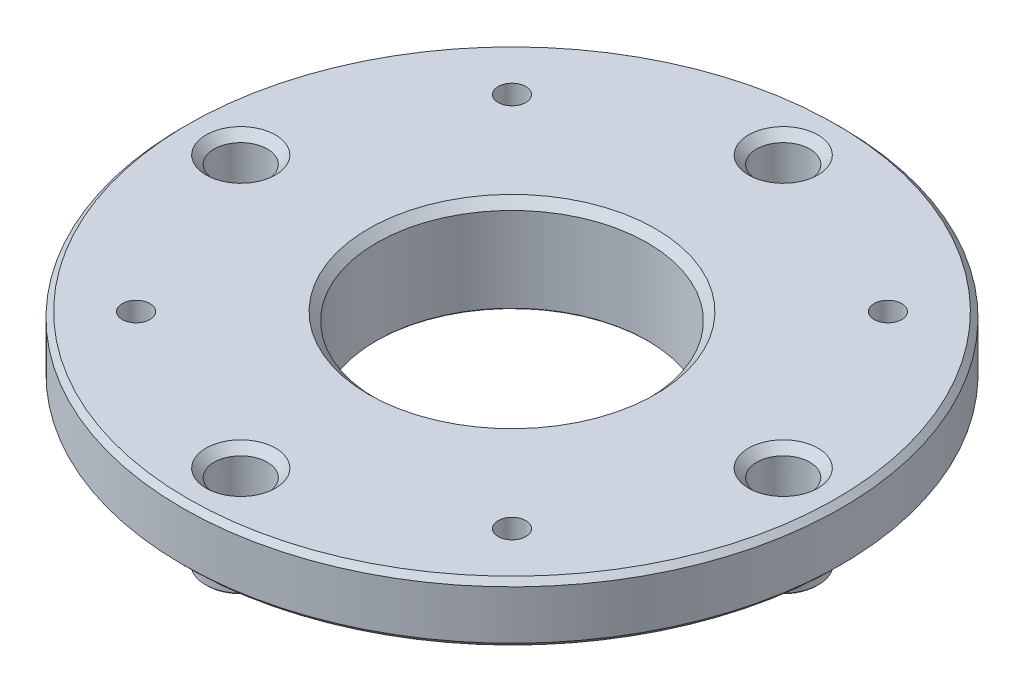
from build123d import *

# Parameters (mm, degrees)
SKETCH1_W                = 60.75
SKETCH1_H                = 11
SKETCH2_R                = 28.485
BOSS_EXTRUDE1_DEPTH      = 6.35
SKETCH3_W                = 6.475
SKETCH3_H                = 4.65
SKETCH4_W                = 6.475
SKETCH4_H                = 4.65
SKETCH5_W                = 6.475
SKETCH5_H                = 4.65
SKETCH6_W                = 6.475
SKETCH6_H                = 4.65
HOLE1_D                  = 5.1054
HOLE1_DEPTH              = 17.35
M8_CLEARANCE_HOLE1_D     = 9.8044
M8_CLEARANCE_HOLE1_DEPTH = 17.35
M45_CLEARANCE_HOLE1_D    = 49.911
M8_CLEARANCE_HOLE2_D     = 9.8044
CHAMFER1_SIZE            = 0.25
CHAMFER2_SIZE            = 1
CHAMFER3_SIZE            = 1.5


with BuildPart() as part:
    # Sketch1 → Revolve1 (revolve)
    with BuildSketch(Plane.XY):
        with Locations((30.375, 5.5)):
            Rectangle(SKETCH1_W, SKETCH1_H)
    revolve(axis=Axis((0, 11, 0), (0, -1, 0)))

    # Sketch2 → Boss-Extrude1 (add)
    with BuildSketch(Plane.XZ):
        Circle(SKETCH2_R)
    extrude(amount=BOSS_EXTRUDE1_DEPTH)

    # Sketch3 → Revolve2 (revolve)
    with BuildSketch(Plane(origin=(0, 0, 0), x_dir=(-1, 0, 0), z_dir=(0, 0, -1))):
        with Locations((46.7625, -2.325)):
            Rectangle(SKETCH3_W, SKETCH3_H)
    revolve(axis=Axis((-50, -4.65, 0), (0, 1, 0)))

    # Sketch4 → Revolve3 (revolve)
    with BuildSketch(Plane(origin=(0, 0, -50), x_dir=(-1, 0, 0), z_dir=(0, 0, -1))):
        with Locations((-3.2375, -2.325)):
            Rectangle(SKETCH4_W, SKETCH4_H)
    revolve(axis=Axis((0, -4.65, -50), (0, 1, 0)))

    # Sketch5 → Revolve4 (revolve)
    with BuildSketch(Plane(origin=(0, 0, 0), x_dir=(-1, 0, 0), z_dir=(0, 0, -1))):
        with Locations((-53.2375, -2.325)):
            Rectangle(SKETCH5_W, SKETCH5_H)
    revolve(axis=Axis((50, -4.65, 0), (0, 1, 0)))

    # Sketch6 → Revolve5 (revolve)
    with BuildSketch(Plane(origin=(0, 0, 50), x_dir=(-1, 0, 0), z_dir=(0, 0, -1))):
        with Locations((-3.2375, -2.325)):
            Rectangle(SKETCH6_W, SKETCH6_H)
    revolve(axis=Axis((0, -4.65, 50), (0, 1, 0)))

    # Hole1
    with Locations(Plane(origin=(0, 11, 0), x_dir=(1, 0, 0), z_dir=(0, 1, 0))):
        with Locations((-34.648232278, -34.648232278), (34.648232278, -34.648232278), (34.648232278, 34.648232278), (-34.648232278, 34.648232278)):
            Hole(HOLE1_D / 2, depth=HOLE1_DEPTH)

    # M8 Clearance Hole1
    with Locations(Plane(origin=(0, 11, 0), x_dir=(1, 0, 0), z_dir=(0, 1, 0))):
        with Locations((50, 0), (0, -50), (-50, 0)):
            Hole(M8_CLEARANCE_HOLE1_D / 2, depth=M8_CLEARANCE_HOLE1_DEPTH)

    # M45 Clearance Hole1 (through all)
    with Locations(Plane(origin=(0, 11, 0), x_dir=(1, 0, 0), z_dir=(0, 1, 0))):
        with Locations((0, 0)):
            Hole(M45_CLEARANCE_HOLE1_D / 2)

    # M8 Clearance Hole2 (through all)
    with Locations(Plane(origin=(0, -4.65, 0), x_dir=(-1, 0, 0), z_dir=(0, -1, 0))):
        with Locations((0, 50)):
            Hole(M8_CLEARANCE_HOLE2_D / 2)

    # Chamfer1
    chamfer1_edges = [part.edges().sort_by_distance(p)[0] for p in [
        (24.9555, -6.35, 0),
        (4.9022, -4.65, 50),
        (-45.0978, -4.65, 0),
        (54.9022, -4.65, 0),
        (-56.475, -4.65, 0),
        (-6.475, -4.65, 50),
        (43.525, -4.65, 0),
        (-4.9022, -4.65, -50),
        (-6.475, -4.65, -50),
    ]]
    chamfer(chamfer1_edges, length=CHAMFER1_SIZE)

    # Chamfer2
    chamfer2_edges = [part.edges().sort_by_distance(p)[0] for p in [
        (-60.75, 11, 0),
        (-60.75, 0, 0),
        (-28.485, -6.35, 0),
    ]]
    chamfer(chamfer2_edges, length=CHAMFER2_SIZE)

    # Chamfer3
    chamfer3_edges = [part.edges().sort_by_distance(p)[0] for p in [
        (-4.9022, 11, -50),
        (54.9022, 11, 0),
        (24.9555, 11, 0),
        (4.9022, 11, 50),
        (-45.0978, 11, 0),
    ]]
    chamfer(chamfer3_edges, length=CHAMFER3_SIZE)


solid = part.part
